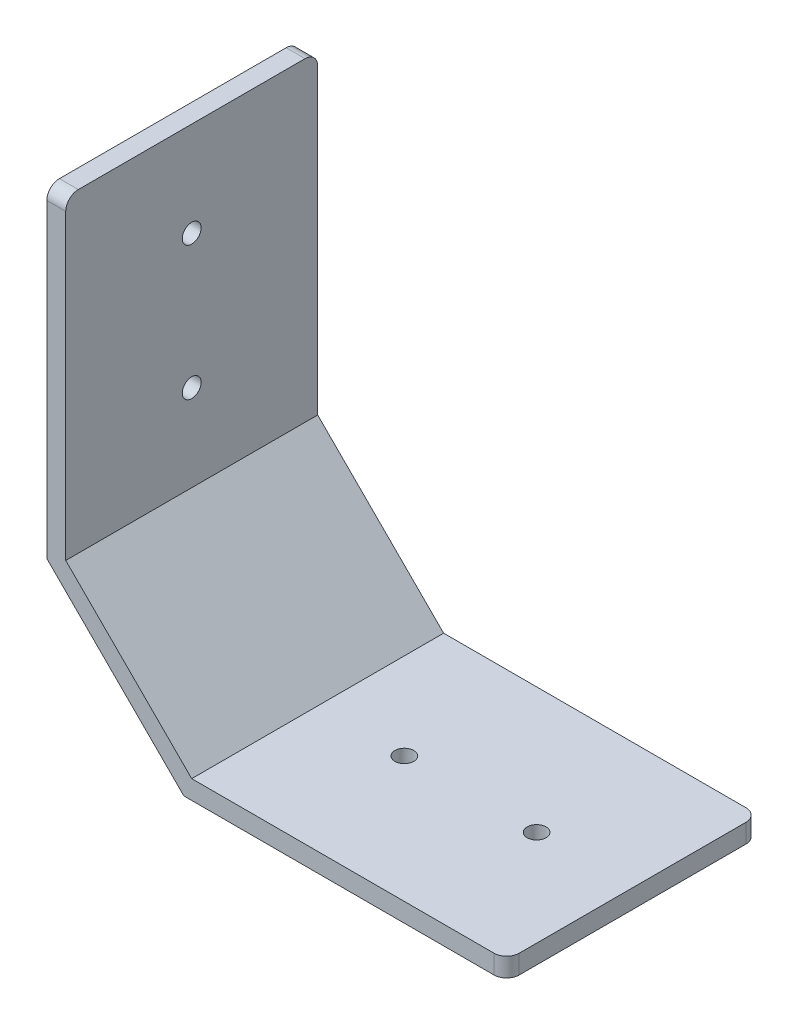
from build123d import *

# Parameters (mm, degrees)
EXTRU_MINCE1_DEPTH      = 40
CONG_3_R                = 2
CONG_4_R                = 2
CONG_5_R                = 2
CONG_6_R                = 2
ESQUISSE2_R             = 1.5
ENL_V_MAT_EXTRU_1_DEPTH = 10
ESQUISSE3_R             = 1.5
ENL_V_MAT_EXTRU_2_DEPTH = 10


with BuildPart() as part:
    # Esquisse1 → Extru.-Mince1 (new body)
    with BuildSketch(Plane.XY):
        Polygon((70, -20), (20, -20), (0, 0), (0, 50), (-3, 50), (-3, -1.242640687), (18.757359313, -23), (70, -23), align=None)
    extrude(amount=EXTRU_MINCE1_DEPTH)

    # Congé3
    cong_3_edges = [part.edges().sort_by_distance(p)[0] for p in [
        (-1.5, 50, 40),
    ]]
    fillet(cong_3_edges, radius=CONG_3_R)

    # Congé4
    cong_4_edges = [part.edges().sort_by_distance(p)[0] for p in [
        (-1.5, 50, 0),
    ]]
    fillet(cong_4_edges, radius=CONG_4_R)

    # Congé5
    cong_5_edges = [part.edges().sort_by_distance(p)[0] for p in [
        (70, -21.5, 40),
    ]]
    fillet(cong_5_edges, radius=CONG_5_R)

    # Congé6
    cong_6_edges = [part.edges().sort_by_distance(p)[0] for p in [
        (70, -21.5, 0),
    ]]
    fillet(cong_6_edges, radius=CONG_6_R)

    # Esquisse2 → Enlèv. mat.-Extru.1 (cut)
    with BuildSketch(Plane.XZ.offset(23)):
        with Locations((33.757359313, 20)):
            Circle(ESQUISSE2_R)
        with Locations((54.757359313, 20)):
            Circle(ESQUISSE2_R)
    extrude(amount=-ENL_V_MAT_EXTRU_1_DEPTH, mode=Mode.SUBTRACT)

    # Esquisse3 → Enlèv. mat.-Extru.2 (cut)
    with BuildSketch(Plane.ZY.offset(3)):
        with Locations((20, 35)):
            Circle(ESQUISSE3_R)
        with Locations((20, 13.757359313)):
            Circle(ESQUISSE3_R)
    extrude(amount=-ENL_V_MAT_EXTRU_2_DEPTH, mode=Mode.SUBTRACT)


solid = part.part
